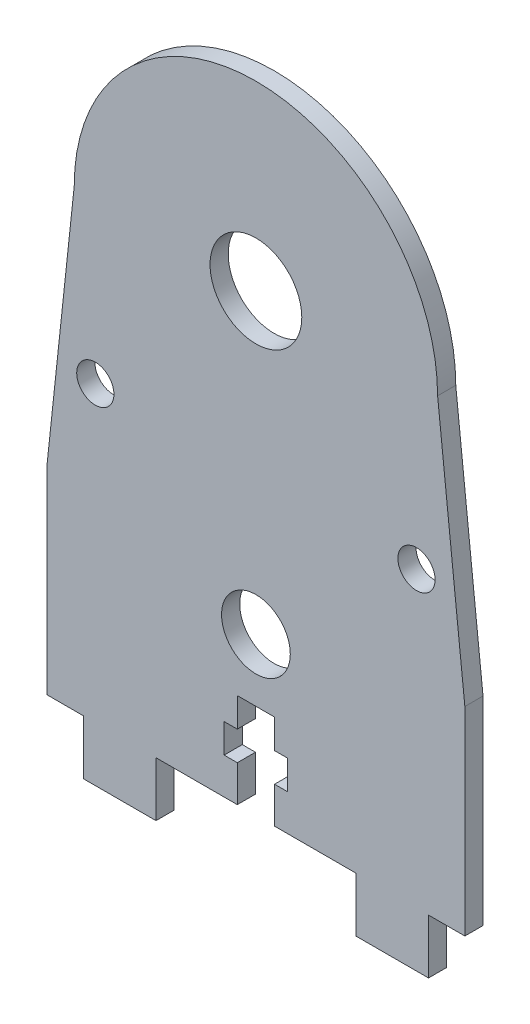
from build123d import *

# Parameters (mm, degrees)
SKETCH_1_R      = 5.05
SKETCH_1_R_2    = 2.05
SKETCH_1_R_3    = 3.783876232
EXTRUDE_1_DEPTH = 2


with BuildPart() as part:
    # 草图1 → 凸台-拉伸1 (new body)
    with BuildSketch(Plane.XY):
        with BuildLine():
            Line((-5.587732913, 20.736278596), (-5.587732913, 24.736278596))
            Line((-5.587732913, 24.736278596), (-4.137732913, 24.736278596))
            Line((-4.137732913, 24.736278596), (-4.137732913, 27.936278596))
            Line((-4.137732913, 27.936278596), (-5.587732913, 27.936278596))
            Line((-5.587732913, 27.936278596), (-5.587732913, 31.136278596))
            Line((-5.587732913, 31.136278596), (-9.687732913, 31.136278596))
            Line((-9.687732913, 31.136278596), (-9.687732913, 27.936278596))
            Line((-9.687732913, 27.936278596), (-11.137732913, 27.936278596))
            Line((-11.137732913, 27.936278596), (-11.137732913, 24.736278596))
            Line((-11.137732913, 24.736278596), (-9.687732913, 24.736278596))
            Line((-9.687732913, 24.736278596), (-9.687732913, 20.736278596))
            Line((-9.687732913, 20.736278596), (-18.637732913, 20.736278596))
            Line((-18.637732913, 20.736278596), (-18.637732913, 14.736278596))
            Line((-18.637732913, 14.736278596), (-26.637732913, 14.736278596))
            Line((-26.637732913, 14.736278596), (-26.637732913, 20.736278596))
            Line((-26.637732913, 20.736278596), (-30.637732913, 20.736278596))
            Line((-30.637732913, 20.736278596), (-30.637732913, 42.62233047))
            Line((-30.637732913, 42.62233047), (-27.637732913, 70.736278596))
            ThreePointArc((-27.637732913, 70.736278596), (-7.637732913, 90.736278596), (12.362267087, 70.736278596))
            Line((12.362267087, 70.736278596), (15.362267087, 42.62233047))
            Line((15.362267087, 42.62233047), (15.362267087, 20.736278596))
            Line((15.362267087, 20.736278596), (11.362267087, 20.736278596))
            Line((11.362267087, 20.736278596), (11.362267087, 14.736278596))
            Line((11.362267087, 14.736278596), (3.362267087, 14.736278596))
            Line((3.362267087, 14.736278596), (3.362267087, 20.736278596))
            Line((3.362267087, 20.736278596), (-5.587732913, 20.736278596))
        make_face()
        with Locations((-7.637732913, 70.736278596)):
            Circle(SKETCH_1_R, mode=Mode.SUBTRACT)
        with Locations((10.039936617, 53.058609066)):
            Circle(SKETCH_1_R_2, mode=Mode.SUBTRACT)
        with Locations((-25.315402443, 53.058609066)):
            Circle(SKETCH_1_R_2, mode=Mode.SUBTRACT)
        with Locations((-7.637732913, 38.004477847)):
            Circle(SKETCH_1_R_3, mode=Mode.SUBTRACT)
    extrude(amount=EXTRUDE_1_DEPTH)


solid = part.part
